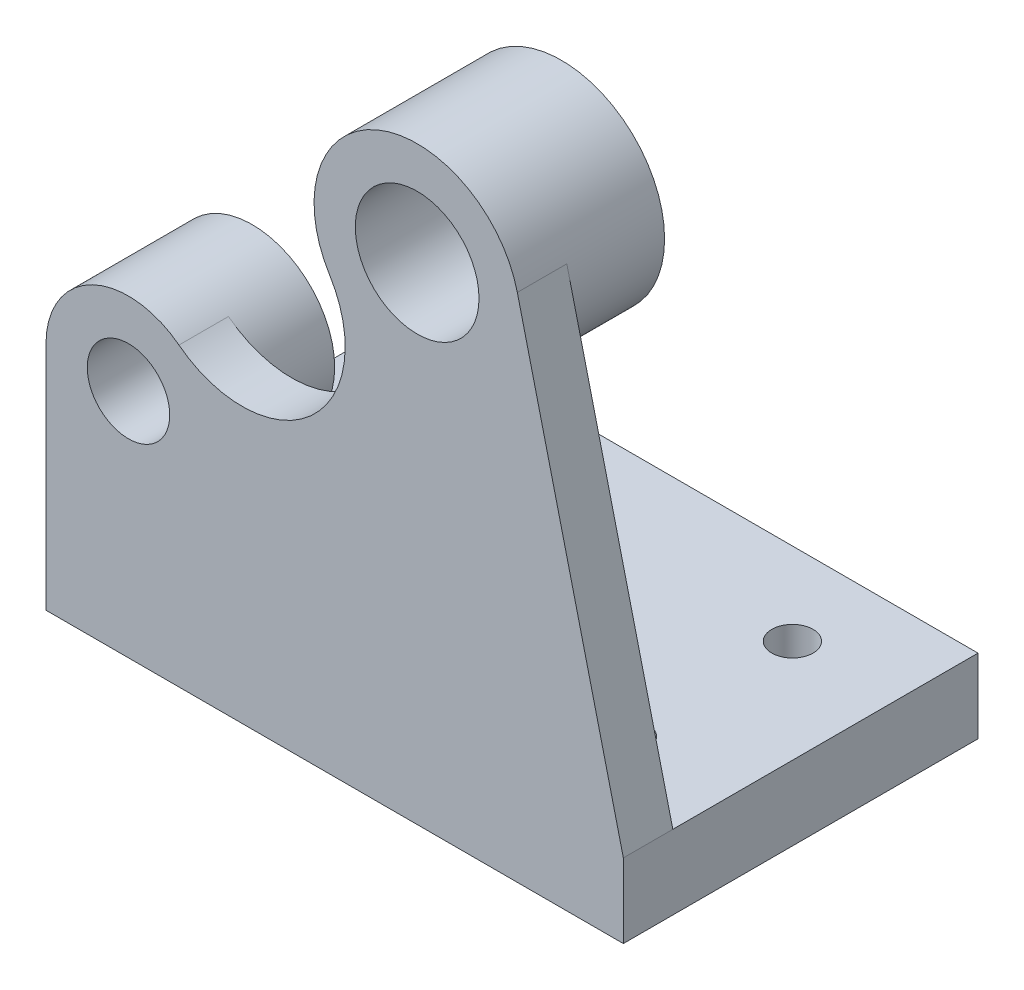
from build123d import *

# Parameters (mm, degrees)
SKETCH1_W            = 140
SKETCH1_H            = 86
BOSS_EXTRUDE1_DEPTH  = 18
BOSS_EXTRUDE2_DEPTH  = 12
SKETCH2_4_R          = 25
SKETCH2_4_R_2        = 15
BOSS_EXTRUDE3_DEPTH  = 35
SKETCH2_6_R          = 20
SKETCH2_6_R_2        = 10
BOSS_EXTRUDE4_DEPTH  = 30
HOLE1_OUTLINE_R      = 5
HOLE1_DEPTH          = 18
LPATTERN1_COUNT      = 2
LPATTERN1_PITCH      = 100
LPATTERN1_COUNT_DIR2 = 2
LPATTERN1_PITCH_DIR2 = 40


# Read off the part's stored shape, not the designer's step: Hole1
with BuildPart() as part:
    # Sketch1 → Boss-Extrude1 (new body)
    with BuildSketch(Plane(origin=(0, 0, 0), x_dir=(1, 0, 0), z_dir=(0, 1, 0))):
        Rectangle(SKETCH1_W, SKETCH1_H)
    extrude(amount=BOSS_EXTRUDE1_DEPTH)

    # Sketch2 → Boss-Extrude2 (add)
    with BuildSketch(Plane.XY.offset(43)):
        with BuildLine():
            ThreePointArc((-30, 56), (-50, 36), (-70, 56))
            Line((-70, 56), (-70, 18))
            Line((-70, 18), (70, 18))
            Line((70, 18), (44.294494718, 123.897247359))
            ThreePointArc((44.294494718, 123.897247359), (44.822997079, 120.969649142), (45, 118))
            ThreePointArc((45, 118), (26.869042098, 93.962191018), (-1.225300853, 104.790662253))
            ThreePointArc((-1.225300853, 104.790662253), (-5.698641076, 73.02406676), (-37.75582298, 71.813922003))
            ThreePointArc((-37.75582298, 71.813922003), (-32.043336329, 64.80671504), (-30, 56))
        make_face()
    extrude(amount=-BOSS_EXTRUDE2_DEPTH)

    # Sketch2<4> → Boss-Extrude3 (add)
    with BuildSketch(Plane.XY.offset(43)):
        with Locations((20, 118)):
            Circle(SKETCH2_4_R)
        with Locations((20, 118)):
            Circle(SKETCH2_4_R_2, mode=Mode.SUBTRACT)
    extrude(amount=-BOSS_EXTRUDE3_DEPTH)

    # Sketch2<6> → Boss-Extrude4 (add)
    with BuildSketch(Plane.XY.offset(43)):
        with Locations((-50, 56)):
            Circle(SKETCH2_6_R)
        with Locations((-50, 56)):
            Circle(SKETCH2_6_R_2, mode=Mode.SUBTRACT)
    extrude(amount=-BOSS_EXTRUDE4_DEPTH)

    # Hole1 outline → Hole1 (cut)
    with BuildSketch(Plane(origin=(0, 0, 0), x_dir=(1, 0, 0), z_dir=(0, 1, 0))):
        with Locations((-55, 23)):
            Circle(HOLE1_OUTLINE_R)
    hole1 = extrude(amount=HOLE1_DEPTH, mode=Mode.SUBTRACT)

    # LPattern1: Hole1 2 × 2
    with Locations(*[(i * LPATTERN1_PITCH, 0, j * LPATTERN1_PITCH_DIR2) for i in range(LPATTERN1_COUNT) for j in range(LPATTERN1_COUNT_DIR2) if (i, j) != (0, 0)]):
        add(hole1, mode=Mode.SUBTRACT)


solid = part.part
